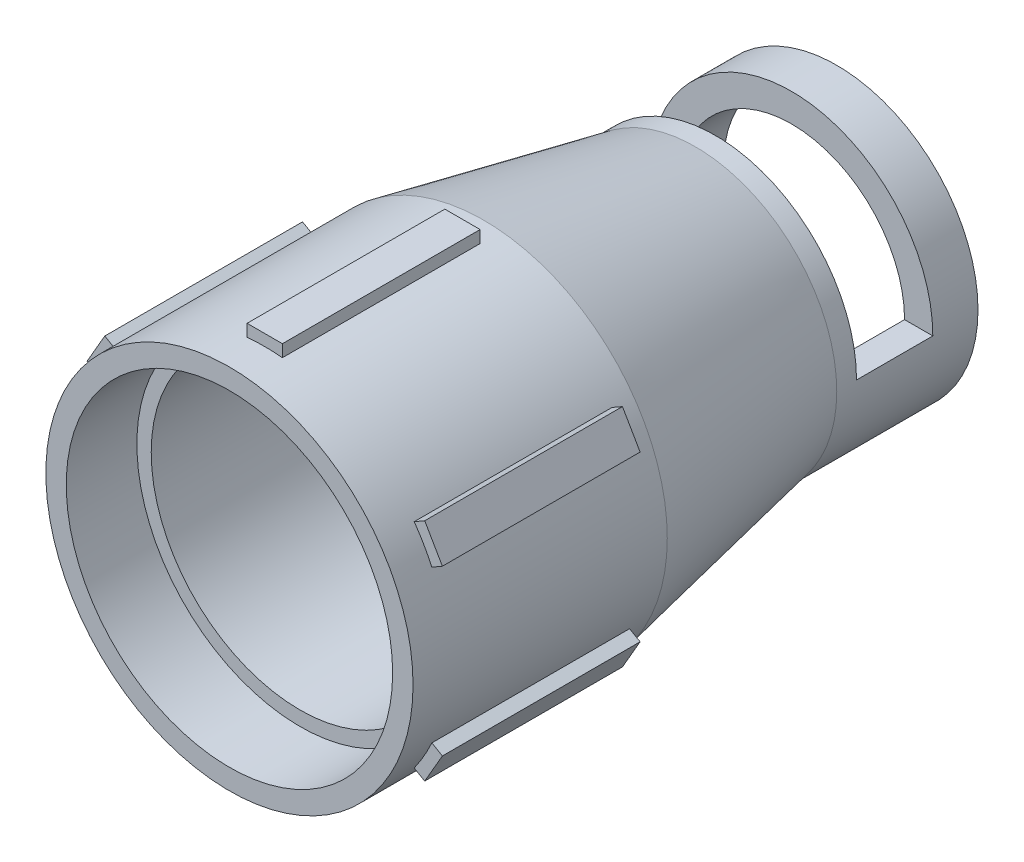
from build123d import *

# Parameters (mm, degrees)
SKETCH3_R          = 14.674629281
CUT_EXTRUDE1_DEPTH = 6.35
SKETCH4_W          = 6.858
SKETCH4_H          = 15.764878236
CUT_EXTRUDE2_DEPTH = 50.8
SKETCH7_W          = 3.175
SKETCH7_H          = 17.78
FINGERGRIP_DEPTH   = 1.651
GRIPS_START        = -20.955
GRIPS_DEPTH        = 17.78


# Read off the part's stored shape, not the designer's step: grips
with BuildPart() as part:
    # Sketch1 → Revolve3 (revolve)
    with BuildSketch(Plane(origin=(0, 0, 0), x_dir=(0, 0, -1), z_dir=(1, 0, 0)), mode=Mode.PRIVATE) as revolve3_sk:
        Polygon((54.61, 12.700000001), (54.61, 10.16), (41.91, 10.16), (22.86, 13.384649532), (0, 13.384649532), (0, 16.51), (22.86, 16.51), (41.91, 12.700000001), align=None)
    revolve(revolve3_sk.sketch.rotate(Axis((0, 0, 0), (0, 0, -1)), 90), axis=Axis((0, 0, 0), (0, 0, -1)))

    # Sketch3 → Cut-Extrude1 (cut)
    with BuildSketch(Plane.XY):
        Circle(SKETCH3_R)
    extrude(amount=-CUT_EXTRUDE1_DEPTH, mode=Mode.SUBTRACT)

    # Sketch4 → Cut-Extrude2 (cut, symmetric)
    with BuildSketch(Plane(origin=(0, 0, 0), x_dir=(0, 0, -1), z_dir=(1, 0, 0))):
        with Locations((47.117, 7.882439118)):
            Rectangle(SKETCH4_W, SKETCH4_H)
    extrude(amount=CUT_EXTRUDE2_DEPTH, both=True, mode=Mode.SUBTRACT)

    # Sketch7 → fingerGrip (add)
    with BuildSketch(Plane(origin=(0, 15.875, 0), x_dir=(-1, 0, 0), z_dir=(0, 1, 0))):
        with Locations((0, -12.065)):
            Rectangle(SKETCH7_W, SKETCH7_H)
    extrude(amount=FINGERGRIP_DEPTH)

    # grips outline → grips (add)
    with BuildSketch(Plane.XY.offset(GRIPS_START)):
        with BuildLine():
            Line((1.5875, -17.526), (1.5875, -16.433500654))
            ThreePointArc((1.5875, -16.433500654), (0, -16.51), (-1.5875, -16.433500654))
            Line((-1.5875, -16.433500654), (-1.5875, -17.526))
            Line((-1.5875, -17.526), (1.5875, -17.526))
        make_face()
        with BuildLine():
            ThreePointArc((15.02557904, -6.841934999), (14.298079416, -8.255), (13.43807904, -9.591565656))
            Line((13.43807904, -9.591565656), (14.384211227, -10.137815329))
            Line((14.384211227, -10.137815329), (15.971711227, -7.388184671))
            Line((15.971711227, -7.388184671), (15.02557904, -6.841934999))
        make_face()
        with BuildLine():
            Line((-14.384211227, -10.137815329), (-13.43807904, -9.591565656))
            ThreePointArc((-13.43807904, -9.591565656), (-14.298079416, -8.255), (-15.02557904, -6.841934999))
            Line((-15.02557904, -6.841934999), (-15.971711227, -7.388184671))
            Line((-15.971711227, -7.388184671), (-14.384211227, -10.137815329))
        make_face()
        with BuildLine():
            Line((-15.971711227, 7.388184671), (-15.02557904, 6.841934999))
            ThreePointArc((-15.02557904, 6.841934999), (-14.298079416, 8.255), (-13.43807904, 9.591565656))
            Line((-13.43807904, 9.591565656), (-14.384211227, 10.137815329))
            Line((-14.384211227, 10.137815329), (-15.971711227, 7.388184671))
        make_face()
        with BuildLine():
            ThreePointArc((13.43807904, 9.591565656), (14.298079416, 8.255), (15.02557904, 6.841934999))
            Line((15.02557904, 6.841934999), (15.971711227, 7.388184671))
            Line((15.971711227, 7.388184671), (14.384211227, 10.137815329))
            Line((14.384211227, 10.137815329), (13.43807904, 9.591565656))
        make_face()
    extrude(amount=GRIPS_DEPTH)


solid = part.part
